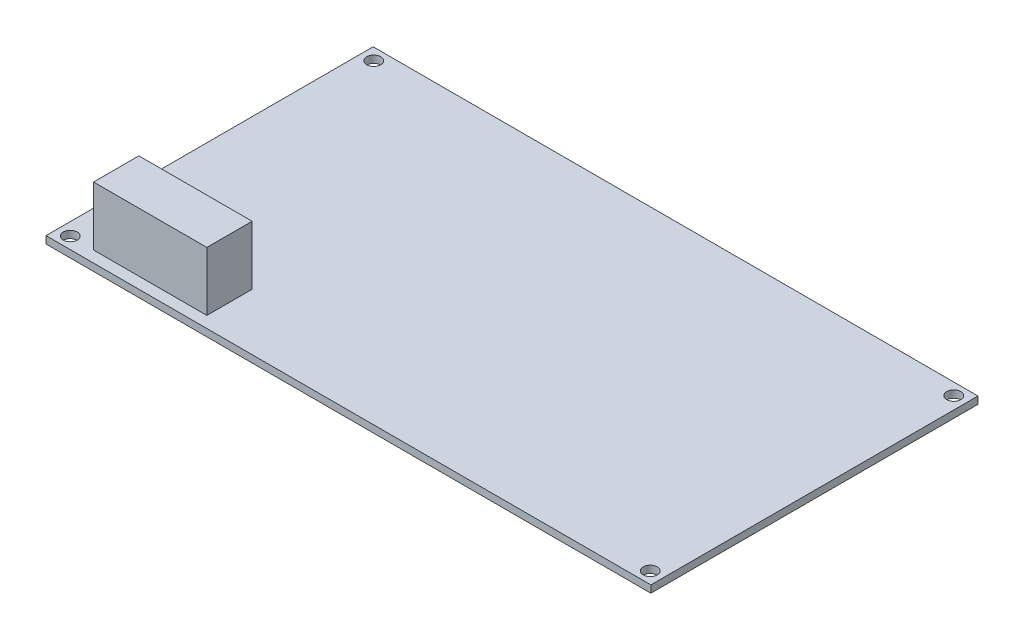
from build123d import *

# Parameters (mm, degrees)
SKETCH1_R           = 1.55
BOSS_EXTRUDE1_DEPTH = 1.6
SKETCH2_W           = 25
SKETCH2_H           = 10
BOSS_EXTRUDE2_DEPTH = 13


with BuildPart() as part:
    # Sketch1 → Boss-Extrude1 (new body)
    with BuildSketch(Plane(origin=(0, 0, 0), x_dir=(1, 0, 0), z_dir=(0, 1, 0))):
        Polygon((0, 36.1), (0, 0), (133.5, 0), (133.5, 72.2), (0, 72.2), align=None)
        with Locations((2.75, 2.6)):
            Circle(SKETCH1_R, mode=Mode.SUBTRACT)
        with Locations((130.75, 2.6)):
            Circle(SKETCH1_R, mode=Mode.SUBTRACT)
        with Locations((2.75, 69.6)):
            Circle(SKETCH1_R, mode=Mode.SUBTRACT)
        with Locations((130.75, 69.6)):
            Circle(SKETCH1_R, mode=Mode.SUBTRACT)
    extrude(amount=BOSS_EXTRUDE1_DEPTH)

    # Sketch2 → Boss-Extrude2 (add)
    with BuildSketch(Plane(origin=(0, 1.6, 0), x_dir=(1, 0, 0), z_dir=(0, 1, 0))):
        with Locations((20.5, 7.5)):
            Rectangle(SKETCH2_W, SKETCH2_H)
    extrude(amount=BOSS_EXTRUDE2_DEPTH)


solid = part.part
